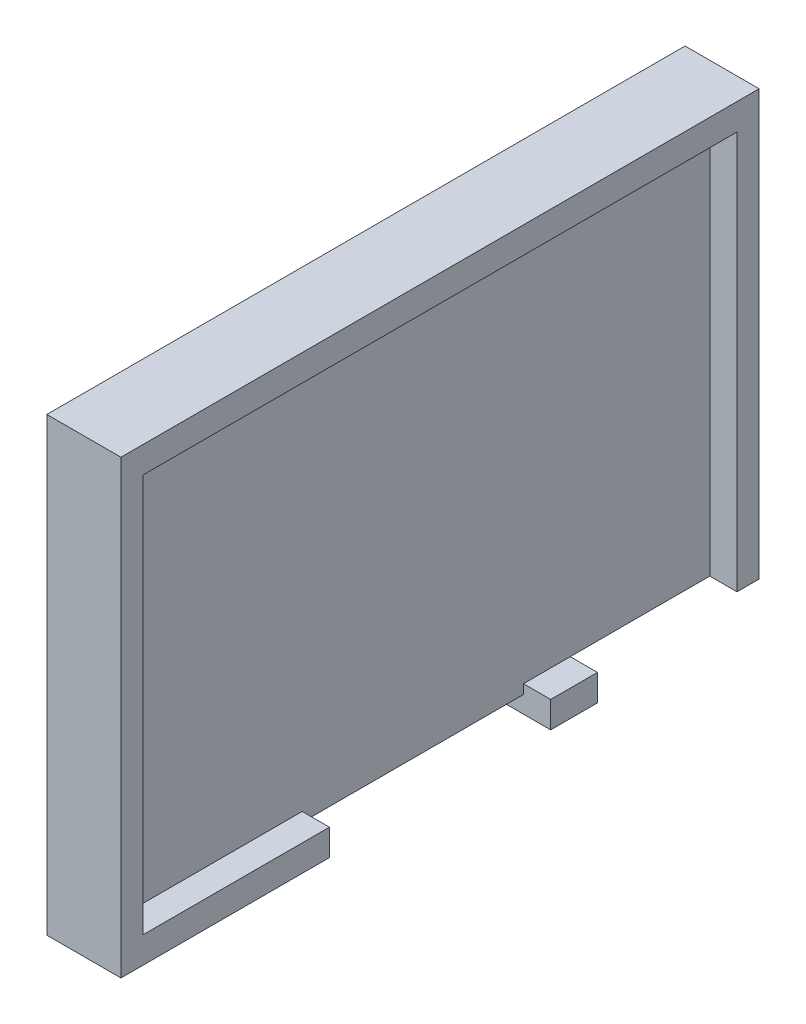
from build123d import *

# Parameters (mm, degrees)
SKETCH1_W           = 26.5
SKETCH1_H           = 37.5
BOSS_EXTRUDE1_DEPTH = 4.353
SKETCH2_W           = 23.4
SKETCH2_H           = 34.9
CUT_EXTRUDE1_DEPTH  = 1.6
SKETCH3_W           = 1.55
SKETCH3_H           = 13
CUT_EXTRUDE2_DEPTH  = 1.6
SKETCH4_W           = 2.753
SKETCH4_H           = 13
CUT_EXTRUDE3_DEPTH  = 1
SKETCH5_W           = 1.55
SKETCH5_H           = 9.5
CUT_EXTRUDE5_DEPTH  = 1.6
CUT_EXTRUDE6_DEPTH  = 9.5
SKETCH7_W           = 9.921470812
SKETCH7_H           = 17.49311959
CUT_EXTRUDE7_DEPTH  = 2
SKETCH10_W          = 1.4
SKETCH10_H          = 3.6
BOSS_EXTRUDE3_DEPTH = 1.6


with BuildPart() as part:
    # Sketch1 → Boss-Extrude1 (new body)
    with BuildSketch(Plane.YZ):
        with Locations((57.87, 107.93)):
            Rectangle(SKETCH1_W, SKETCH1_H)
    extrude(amount=BOSS_EXTRUDE1_DEPTH)

    # Sketch2 → Cut-Extrude1 (cut)
    with BuildSketch(Plane.YZ.offset(4.353)):
        with Locations((57.87, 107.93)):
            Rectangle(SKETCH2_W, SKETCH2_H)
    extrude(amount=-CUT_EXTRUDE1_DEPTH, mode=Mode.SUBTRACT)

    # Sketch3 → Cut-Extrude2 (cut)
    with BuildSketch(Plane.YZ.offset(4.353)):
        with Locations((45.395, 107.93)):
            Rectangle(SKETCH3_W, SKETCH3_H)
    extrude(amount=-CUT_EXTRUDE2_DEPTH, mode=Mode.SUBTRACT)

    # Sketch4 → Cut-Extrude3 (cut)
    with BuildSketch(Plane.XZ.offset(-44.62)):
        with Locations((1.3765, 107.93)):
            Rectangle(SKETCH4_W, SKETCH4_H)
    extrude(amount=-CUT_EXTRUDE3_DEPTH, mode=Mode.SUBTRACT)

    # Sketch5 → Cut-Extrude5 (cut)
    with BuildSketch(Plane.YZ.offset(4.353)):
        with Locations((45.395, 93.93)):
            Rectangle(SKETCH5_W, SKETCH5_H)
    extrude(amount=-CUT_EXTRUDE5_DEPTH, mode=Mode.SUBTRACT)

    # Sketch6 → Cut-Extrude6 (cut)
    with BuildSketch(Plane(origin=(0, 0, 89.18), x_dir=(1, 0, 0), z_dir=(0, 0, -1))):
        Polygon((1.953, -46.17), (2.753, -46.17), (2.753, -44.62), (0, -44.62), (0, -49.12), (1.953, -49.12), align=None)
    extrude(amount=-CUT_EXTRUDE6_DEPTH, mode=Mode.SUBTRACT)

    # Sketch7 → Cut-Extrude7 (cut)
    with BuildSketch(Plane(origin=(0, 0, 0), x_dir=(0, -1, 0), z_dir=(-1, 0, 0))):
        with Locations((-61.879572923, 107.531107948)):
            Rectangle(SKETCH7_W, SKETCH7_H)
        Polygon((-57.329123903, 95.837945919), (-57.329123903, 90.653417938), (-49.12, 90.653417938), (-49.12, 95.837945919), (-50.242359038, 95.837945919), (-50.242359038, 122.506561072), (-54.830106819, 122.506561072), (-54.830106819, 95.837945919), align=None)
    extrude(amount=-CUT_EXTRUDE7_DEPTH, mode=Mode.SUBTRACT)

    # Sketch10 → Boss-Extrude3 (add)
    with BuildSketch(Plane(origin=(0, 0, 0), x_dir=(0, -1, 0), z_dir=(-1, 0, 0))):
        with Locations((-68.22, 123.18)):
            Rectangle(SKETCH10_W, SKETCH10_H)
    boss_extrude3 = extrude(amount=BOSS_EXTRUDE3_DEPTH)

    # Mirror1: Boss-Extrude3 across plane
    add(boss_extrude3.mirror(Plane(origin=(0, 57.62, 0), x_dir=(0, 0, 1), z_dir=(0, -1, 0))))

    # Mirror2: Boss-Extrude3 across plane
    add(boss_extrude3.mirror(Plane.XY.offset(107.93)))


solid = part.part
